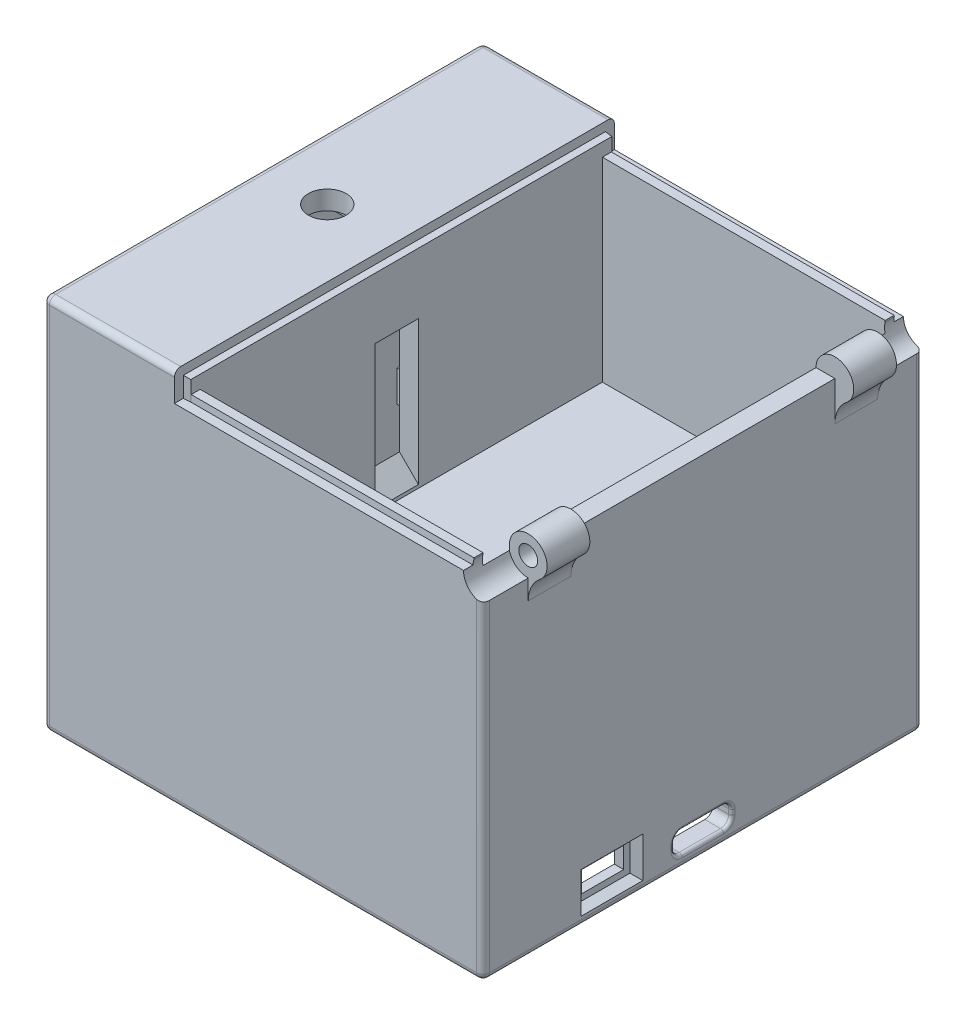
from build123d import *

# Parameters (mm, degrees)
SKETCH_1_W                       = 70
SKETCH_1_H                       = 70
EXTRUDE_1_DEPTH                  = 60
SKETCH_3_W                       = 48
SKETCH_3_H                       = 4.6
CUT_EXTRUDE_1_DEPTH              = 99.615414617
SKETCH_4_W                       = 45
SKETCH_4_H                       = 64
CUT_EXTRUDE_2_DEPTH              = 30
SKETCH_5_R                       = 1.5
CUT_EXTRUDE_3_DEPTH              = 8
SHELL_2_DEPTH                    = 22.4
SHELL_START                      = 11
SHELL_2_2_OUTLINE_W              = 16
SHELL_2_2_OUTLINE_H              = 64
SHELL_2_2_DEPTH                  = 46
SHELL_2_3_DEPTH                  = 11.4
EXTRUDE_2_DEPTH                  = 11
SKETCH_7_R                       = 3
CUT_EXTRUDE_4_DEPTH              = 78.781745931
CUT_EXTRUDE_5_DEPTH              = 2
MACRO_START                      = -14
MACRO_FEATURE_2_DEPTH            = 46
MACRO_START_2                    = 58.576919493
MACRO_FEATURE_3_OUTLINE_W        = 1.1
MACRO_FEATURE_3_OUTLINE_H        = 70
MACRO_FEATURE_3_DEPTH            = 2.423080507
MACRO_START_3                    = 55.4
MACRO_FEATURE_3_2_DEPTH          = 4.6
MACRO_START_4                    = 57.450662782
MACRO_FEATURE_3_3_DEPTH          = 1.549337218
EXTRUDE_START                    = 15
SKETCH_10_W                      = 13.406925948
SKETCH_10_H                      = 1
EXTRUDE_3_DEPTH                  = 8
SKETCH_11_W                      = 5.5
SKETCH_11_H                      = 2.5
CUT_EXTRUDE_6_DEPTH              = 1
EXTRUDE_START_2                  = 38
SKETCH_12_W                      = 4.8
SKETCH_12_H                      = 12.2
SKETCH_12_R                      = 1.1
EXTRUDE_4_DEPTH                  = 5
EXTRUDE_START_3                  = 17.5
SKETCH_13_W                      = 12.2
SKETCH_13_H                      = 5
SKETCH_13_R                      = 1.1
EXTRUDE_5_DEPTH                  = 4
SKETCH_14_R                      = 3
CUT_EXTRUDE_8_DEPTH              = 14
CUT_EXTRUDE_START                = -56
SKETCH_14_2_R                    = 3
CUT_EXTRUDE_9_DEPTH              = 14
EXTRUDE_START_4                  = -0.0001
EXTRUDE_6_OUTLINE_R              = 1.5
EXTRUDE_6_DEPTH                  = 6.8001
EXTRUDE_START_5                  = -42
SKETCH_15_2_R                    = 3
SKETCH_15_2_R_2                  = 1.5
EXTRUDE_7_DEPTH                  = 6.8
CHAMFER_1_SIZE                   = 4
CHAMFER_2_SIZE                   = 4
CHAMFER_3_SIZE                   = 4
CHAMFER_4_SIZE                   = 3
DRAFT_3_ANGLE                    = 10
DRAFT_4_ANGLE                    = 10
SKETCH_16_W                      = 13.480482799
SKETCH_16_H                      = 1.221651596
EXTRUDE_8_DEPTH                  = 1
FILLET_1_R                       = 5
FILLET_2_R                       = 5
CUT_EXTRUDE_10_REACH             = 100.615
SKETCH_19_W                      = 6.720419017
SKETCH_19_H                      = 3.339338642
CUT_EXTRUDE_10_DIRECTION_2_DEPTH = 99.615414617
CUT_EXTRUDE_11_REACH             = 64.178
SKETCH_20_W                      = 16.413114716
SKETCH_20_H                      = 3.11419251
CUT_EXTRUDE_12_REACH             = 88.174
SKETCH_22_W                      = 8.720419017
SKETCH_22_H                      = 5.339338642
CUT_EXTRUDE_13_DEPTH             = 1.5
FILLET_3_R                       = 1
DRAFT_5_ANGLE                    = 20
FILLET_4_R                       = 0.5
SKETCH_23_R                      = 1.5
EXTRUDE_9_DEPTH                  = 1
SKETCH_24_R                      = 1.5
EXTRUDE_10_DEPTH                 = 1
SKETCH_25_R                      = 1.489272612
CUT_EXTRUDE_14_DEPTH             = 2.6
SKETCH_26_R                      = 1.236152459
CUT_EXTRUDE_15_DEPTH             = 2.6
CUT_EXTRUDE_16_REACH             = 101.72
SKETCH_27_R                      = 3.1
CUT_EXTRUDE_START_2              = -7.2
SKETCH_28_R                      = 3.1
CUT_EXTRUDE_17_DEPTH             = 7.2
CUT_EXTRUDE_20_DEPTH             = 0.5
CUT_EXTRUDE_21_DEPTH             = 0.5
CUT_EXTRUDE_22_DEPTH             = 0.5
CUT_EXTRUDE_23_DEPTH             = 0.5
CUT_EXTRUDE_25_DEPTH             = 0.5
SKETCH_31_10_RX                  = 0.631397951
SKETCH_31_10_RY                  = 0.430393735
CUT_EXTRUDE_26_DEPTH             = 0.5
CUT_EXTRUDE_27_DEPTH             = 0.5
CHAMFER_5_SIZE                   = 3
CHAMFER_6_SIZE                   = 3


with BuildPart() as part:
    # 草图1 → 凸台-拉伸1 (new body)
    with BuildSketch(Plane(origin=(0, 0, 0), x_dir=(1, 0, 0), z_dir=(0, 1, 0))):
        Rectangle(SKETCH_1_W, SKETCH_1_H)
    extrude(amount=EXTRUDE_1_DEPTH)

    # 草图3 → 切除-拉伸1 (cut, through all)
    with BuildSketch(Plane.XY.offset(35)):
        with Locations((11, 57.7)):
            Rectangle(SKETCH_3_W, SKETCH_3_H)
    extrude(amount=-CUT_EXTRUDE_1_DEPTH, mode=Mode.SUBTRACT)

    # 草图4 → 切除-拉伸2 (cut)
    with BuildSketch(Plane(origin=(0, 55.4, 0), x_dir=(1, 0, 0), z_dir=(0, 1, 0))):
        with Locations((9.5, 0)):
            Rectangle(SKETCH_4_W, SKETCH_4_H)
    extrude(amount=-CUT_EXTRUDE_2_DEPTH, mode=Mode.SUBTRACT)

    # 草图5 → 切除-拉伸3 (cut)
    with BuildSketch(Plane.XZ):
        with Locations(Location((-28, 28, 0), (0, 0, 270))):
            Circle(SKETCH_5_R)
        with Locations(Location((28, 28, 0), (0, 0, 270))):
            Circle(SKETCH_5_R)
        with Locations(Location((28, -28, 0), (0, 0, 270))):
            Circle(SKETCH_5_R)
        with Locations(Location((-28, -28, 0), (0, 0, 270))):
            Circle(SKETCH_5_R)
    extrude(amount=-CUT_EXTRUDE_3_DEPTH, mode=Mode.SUBTRACT)

    # 抽壳2: read off the stored shape, not the designer's step
    # 抽壳2 outline → 抽壳2 (cut)
    with BuildSketch(Plane(origin=(0, 0, 0), x_dir=(1, 0, 0), z_dir=(0, 1, 0))):
        with BuildLine():
            Line((-30.061552813, 32), (-32, 32))
            Line((-32, 32), (-32, 30.061552813))
            ThreePointArc((-32, 30.061552813), (-31.181980515, 31.181980515), (-30.061552813, 32))
        make_face()
        with BuildLine():
            ThreePointArc((-25.938447187, 32), (-24.818019485, 24.818019485), (-32, 25.938447187))
            Line((-32, 25.938447187), (-32, -25.938447187))
            ThreePointArc((-32, -25.938447187), (-24.818019485, -24.818019485), (-25.938447187, -32))
            Line((-25.938447187, -32), (25.938447187, -32))
            ThreePointArc((25.938447187, -32), (24.818019485, -24.818019485), (32, -25.938447187))
            Line((32, -25.938447187), (32, 25.938447187))
            ThreePointArc((32, 25.938447187), (24.818019485, 24.818019485), (25.938447187, 32))
            Line((25.938447187, 32), (-25.938447187, 32))
        make_face()
        with BuildLine():
            ThreePointArc((-30.061552813, -32), (-31.181980515, -31.181980515), (-32, -30.061552813))
            Line((-32, -30.061552813), (-32, -32))
            Line((-32, -32), (-30.061552813, -32))
        make_face()
        with BuildLine():
            Line((32, 32), (30.061552813, 32))
            ThreePointArc((30.061552813, 32), (31.181980515, 31.181980515), (32, 30.061552813))
            Line((32, 30.061552813), (32, 32))
        make_face()
        with BuildLine():
            ThreePointArc((32, -30.061552813), (31.181980515, -31.181980515), (30.061552813, -32))
            Line((30.061552813, -32), (32, -32))
            Line((32, -32), (32, -30.061552813))
        make_face()
    extrude(amount=SHELL_2_DEPTH, mode=Mode.SUBTRACT)

    # Shell 2 2 outline → Shell 2 2 (cut)
    with BuildSketch(Plane(origin=(0, 0, 0), x_dir=(1, 0, 0), z_dir=(0, 1, 0)).offset(SHELL_START)):
        with Locations((-24, 0)):
            Rectangle(SHELL_2_2_OUTLINE_W, SHELL_2_2_OUTLINE_H)
    extrude(amount=SHELL_2_2_DEPTH, mode=Mode.SUBTRACT)

    # Shell 2 3 outline → Shell 2 3 (cut)
    with BuildSketch(Plane(origin=(0, 0, 0), x_dir=(1, 0, 0), z_dir=(0, 1, 0)).offset(SHELL_START)):
        with BuildLine():
            Line((30.061552813, 32), (25.938447187, 32))
            ThreePointArc((25.938447187, 32), (24.818019485, 24.818019485), (32, 25.938447187))
            Line((32, 25.938447187), (32, 30.061552813))
            ThreePointArc((32, 30.061552813), (31.181980515, 31.181980515), (30.061552813, 32))
        make_face()
        with BuildLine():
            ThreePointArc((32, -25.938447187), (24.818019485, -24.818019485), (25.938447187, -32))
            Line((25.938447187, -32), (30.061552813, -32))
            ThreePointArc((30.061552813, -32), (31.181980515, -31.181980515), (32, -30.061552813))
            Line((32, -30.061552813), (32, -25.938447187))
        make_face()
    extrude(amount=SHELL_2_3_DEPTH, mode=Mode.SUBTRACT)

    # 草图6 → 凸台-拉伸2 (add)
    with BuildSketch(Plane.XZ):
        with BuildLine():
            Line((-32, 30.061552813), (-32, 32))
            Line((-32, 32), (-30.061552813, 32))
            ThreePointArc((-30.061552813, 32), (-31.181980515, 31.181980515), (-32, 30.061552813))
        make_face()
        with BuildLine():
            Line((32, 32), (32, 30.061552813))
            ThreePointArc((32, 30.061552813), (31.181980515, 31.181980515), (30.061552813, 32))
            Line((30.061552813, 32), (32, 32))
        make_face()
        with BuildLine():
            Line((-32, -32), (-32, -30.061552813))
            ThreePointArc((-32, -30.061552813), (-31.181980515, -31.181980515), (-30.061552813, -32))
            Line((-30.061552813, -32), (-32, -32))
        make_face()
        with BuildLine():
            Line((32, -30.061552813), (32, -32))
            Line((32, -32), (30.061552813, -32))
            ThreePointArc((30.061552813, -32), (31.181980515, -31.181980515), (32, -30.061552813))
        make_face()
    extrude(amount=-EXTRUDE_2_DEPTH)

    # 草图7 → 切除-拉伸4 (cut, through all)
    with BuildSketch(Plane(origin=(0, 60, 0), x_dir=(1, 0, 0), z_dir=(0, 1, 0))):
        with Locations(Location((-24.782622857, 0, 0), (0, 0, 270))):
            Circle(SKETCH_7_R)
    extrude(amount=-CUT_EXTRUDE_4_DEPTH, mode=Mode.SUBTRACT)

    # 草图8 → 切除-拉伸5 (cut)
    with BuildSketch(Plane.XZ):
        with BuildLine():
            Line((-29, 32), (29, 32))
            ThreePointArc((29, 32), (31.121320344, 31.121320344), (32, 29))
            Line((32, 29), (32, -29))
            ThreePointArc((32, -29), (31.121320344, -31.121320344), (29, -32))
            Line((29, -32), (-29, -32))
            ThreePointArc((-29, -32), (-31.121320344, -31.121320344), (-32, -29))
            Line((-32, -29), (-32, 29))
            ThreePointArc((-32, 29), (-31.121320344, 31.121320344), (-29, 32))
        make_face()
    extrude(amount=-CUT_EXTRUDE_5_DEPTH, mode=Mode.SUBTRACT)

    # Macro Feature 2: read off the stored shape, not the designer's step
    # Macro Feature 2 outline → Macro Feature 2 (add)
    with BuildSketch(Plane.YZ.offset(MACRO_START)):
        Polygon((55.4, -32), (55.4, -33.5), (56.4, -33.430073188), (56.4, -32), align=None)
        Polygon((55.4, 33.5), (55.4, 32), (56.4, 32), (56.4, 33.430073188), align=None)
    extrude(amount=MACRO_FEATURE_2_DEPTH)

    # Macro Feature 3: read off the stored shape, not the designer's step
    # Macro Feature 3 outline → Macro Feature 3 (cut)
    with BuildSketch(Plane(origin=(0, 0, 0), x_dir=(1, 0, 0), z_dir=(0, 1, 0)).offset(MACRO_START_2)):
        with Locations((-13.55, 0)):
            Rectangle(MACRO_FEATURE_3_OUTLINE_W, MACRO_FEATURE_3_OUTLINE_H)
    extrude(amount=MACRO_FEATURE_3_DEPTH, mode=Mode.SUBTRACT)

    # Macro Feature 3 2 outline → Macro Feature 3 2 (cut)
    with BuildSketch(Plane(origin=(0, 0, 0), x_dir=(1, 0, 0), z_dir=(0, 1, 0)).offset(MACRO_START_3)):
        Polygon((-14.1, 35), (-14.1, 33.576919493), (-13, 33.5), (-13, 35), align=None)
        Polygon((-13, -33.5), (-14.1, -33.576919493), (-14.1, -35), (-13, -35), align=None)
    extrude(amount=MACRO_FEATURE_3_2_DEPTH, mode=Mode.SUBTRACT)

    # Macro Feature 3 3 outline → Macro Feature 3 3 (cut)
    with BuildSketch(Plane(origin=(0, 0, 0), x_dir=(0.9975640502598242, -0.06975647374412533, 0), z_dir=(0.06975647374412533, 0.9975640502598243, 0)).offset(MACRO_START_4)):
        Polygon((-18.151772455, -33.576919493), (-17.049086367, -33.5), (-17.049086367, 33.5), (-18.151772455, 33.576919493), align=None)
    extrude(amount=MACRO_FEATURE_3_3_DEPTH, mode=Mode.SUBTRACT)

    # 草图10 → 凸台-拉伸3 (add)
    with BuildSketch(Plane.XY.offset(-32).offset(EXTRUDE_START)):
        with Locations((-22.703462974, 56.5)):
            Rectangle(SKETCH_10_W, SKETCH_10_H)
    extrude(amount=EXTRUDE_3_DEPTH)

    # 草图11 → 切除-拉伸6 (cut)
    with BuildSketch(Plane.XZ.offset(-56)):
        with Locations((-18.75, -13.25)):
            Rectangle(SKETCH_11_W, SKETCH_11_H)
        with Locations((-25.35, -13.25)):
            Rectangle(SKETCH_11_W, SKETCH_11_H)
    extrude(amount=-CUT_EXTRUDE_6_DEPTH, mode=Mode.SUBTRACT)

    # 草图12 → 凸台-拉伸4 (add)
    # profile 1 of 2: a face of its own
    with BuildSketch(Plane.XY.offset(-32).offset(EXTRUDE_START_2)):
        with Locations((1.8, 16.3)):
            Rectangle(SKETCH_12_W, SKETCH_12_H)
        with Locations((1.8, 16.3)):
            Circle(SKETCH_12_R, mode=Mode.SUBTRACT)
    # profile 2 of 2: a face of its own
    with BuildSketch(Plane.XY.offset(-32).offset(EXTRUDE_START_2)):
        with Locations((29.6, 16.3)):
            Rectangle(SKETCH_12_W, SKETCH_12_H)
        with Locations((29.6, 16.3)):
            Circle(SKETCH_12_R, mode=Mode.SUBTRACT)
    extrude(amount=EXTRUDE_4_DEPTH)

    # 草图13 → 凸台-拉伸5 (add)
    with BuildSketch(Plane.XY.offset(-32).offset(EXTRUDE_START_3)):
        with Locations((-22.1, 26)):
            Rectangle(SKETCH_13_W, SKETCH_13_H)
        with Locations((-22.1, 27.05)):
            Circle(SKETCH_13_R, mode=Mode.SUBTRACT)
    extrude(amount=-EXTRUDE_5_DEPTH)

    # 草图14 → 切除-拉伸8 (cut)
    with BuildSketch(Plane.XY.offset(35)):
        with Locations((35, 55.4)):
            Circle(SKETCH_14_R)
    extrude(amount=-CUT_EXTRUDE_8_DEPTH, mode=Mode.SUBTRACT)

    # 草图14<2> → 切除-拉伸9 (cut)
    with BuildSketch(Plane.XY.offset(35).offset(CUT_EXTRUDE_START)):
        with Locations((35, 55.4)):
            Circle(SKETCH_14_2_R)
    extrude(amount=-CUT_EXTRUDE_9_DEPTH, mode=Mode.SUBTRACT)

    # 凸台-拉伸6: read off the stored shape, not the designer's step
    # 凸台-拉伸6 outline → 凸台-拉伸6 (add)
    with BuildSketch(Plane.XY.offset(21).offset(EXTRUDE_START_4)):
        with BuildLine():
            ThreePointArc((32, 55.4), (32.878679656, 53.278679656), (35, 52.4))
            ThreePointArc((35, 52.4), (37.121320344, 57.521320344), (32, 55.4))
        make_face()
        with Locations((35, 55.4)):
            Circle(EXTRUDE_6_OUTLINE_R, mode=Mode.SUBTRACT)
    extrude(amount=EXTRUDE_6_DEPTH)

    # 草图15<2> → 凸台-拉伸7 (add)
    with BuildSketch(Plane.XY.offset(21).offset(EXTRUDE_START_5)):
        with Locations((35, 55.4)):
            Circle(SKETCH_15_2_R)
        with Locations((35, 55.4)):
            Circle(SKETCH_15_2_R_2, mode=Mode.SUBTRACT)
    extrude(amount=-EXTRUDE_7_DEPTH)

    # 倒角1
    chamfer_1_edges = [part.edges().sort_by_distance(p)[0] for p in [
        (1.8, 22.4, 6),
    ]]
    chamfer(chamfer_1_edges, length=CHAMFER_1_SIZE)

    # 倒角2
    chamfer_2_edges = [part.edges().sort_by_distance(p)[0] for p in [
        (-0.6, 22.4, 6.5),
    ]]
    chamfer(chamfer_2_edges, length=CHAMFER_2_SIZE)

    # 倒角3
    # the kernel refuses this chamfer: 4 mm, written as the material it adds along each edge
    with BuildSketch(Plane(origin=(-16, 23.5, -14.5), x_dir=(0, -1, 0), z_dir=(0, 0, -1))) as chamfer_3_piece_1_section:
        Polygon((CHAMFER_3_SIZE, 0), (0, CHAMFER_3_SIZE), (0, 0), align=None)
    chamfer_3_piece_1 = extrude(amount=4, mode=Mode.PRIVATE)
    chamfer_3_piece_1 = split(chamfer_3_piece_1, bisect_by=Plane(origin=(-16, 22.4, -14.5), z_dir=(0, 1, 0)), keep=Keep.TOP, mode=Mode.PRIVATE)
    add(chamfer_3_piece_1)

    # 倒角4
    chamfer_4_edges = [part.edges().sort_by_distance(p)[0] for p in [
        (-16, 25.45, -18.5),
    ]]
    chamfer(chamfer_4_edges, length=CHAMFER_4_SIZE)

    # 拔模3
    draft_3_faces = [part.faces().sort_by_distance(p)[0] for p in [
        (-18.75, 56.5, -12),
        (-21.5, 56.5, -13.25),
        (-18.75, 56.5, -14.5),
    ]]
    draft(draft_3_faces, Plane(origin=(0, 57, 0), x_dir=(0, 0, -1), z_dir=(0, -1, 0)), DRAFT_3_ANGLE)

    # 拔模4
    draft_4_faces = [part.faces().sort_by_distance(p)[0] for p in [
        (-28.1, 56.5, -13.25),
        (-25.35, 56.5, -12),
        (-25.35, 56.5, -14.5),
        (-22.6, 56.5, -13.25),
    ]]
    draft(draft_4_faces, Plane(origin=(0, 57, 0), x_dir=(0, 0, -1), z_dir=(0, -1, 0)), DRAFT_4_ANGLE)

    # 草图16 → 凸台-拉伸8 (add)
    with BuildSketch(Plane.XZ.offset(-57)):
        with Locations((-24.782622857, -4.273489786)):
            Rectangle(SKETCH_16_W, SKETCH_16_H)
        with Locations((-24.782622857, 4.273489786)):
            Rectangle(SKETCH_16_W, SKETCH_16_H)
    extrude(amount=EXTRUDE_8_DEPTH)

    # 圆角1
    fillet_1_edges = [part.edges().sort_by_distance(p)[0] for p in [
        (35, 52.4, 24.39995),
    ]]
    fillet(fillet_1_edges, radius=FILLET_1_R)

    # 圆角2
    fillet_2_edges = [part.edges().sort_by_distance(p)[0] for p in [
        (35, 52.4, -24.4),
    ]]
    fillet(fillet_2_edges, radius=FILLET_2_R)

    # 草图19 → 切除-拉伸10 (cut, up to next)
    with BuildSketch(Plane(origin=(35, 0, 0), x_dir=(0, 0, -1), z_dir=(1, 0, 0)), mode=Mode.PRIVATE) as cut_extrude_10_sk1:
        with Locations((-14.471315698, 4.702200093)):
            Rectangle(SKETCH_19_W, SKETCH_19_H)
    cut_extrude_10_tool1 = extrude(cut_extrude_10_sk1.sketch, amount=-CUT_EXTRUDE_10_REACH, mode=Mode.PRIVATE) & part.part
    # 草图19 → 切除-拉伸10 (cut, up to next)
    with BuildSketch(Plane(origin=(35, 0, 0), x_dir=(0, 0, -1), z_dir=(1, 0, 0)), mode=Mode.PRIVATE) as cut_extrude_10_sk2:
        with BuildLine():
            Line((-3.282090948, 5.352712816), (3.293659264, 5.352712816))
            ThreePointArc((3.293659264, 5.352712816), (4.21289808, 4.971951631), (4.593659264, 4.052712816))
            Line((4.593659264, 4.052712816), (4.593659264, 3.28436082))
            ThreePointArc((4.593659264, 3.28436082), (4.21289808, 2.365122004), (3.293659264, 1.98436082))
            Line((3.293659264, 1.98436082), (-3.282090948, 1.98436082))
            ThreePointArc((-3.282090948, 1.98436082), (-4.201329763, 2.365122004), (-4.582090948, 3.28436082))
            Line((-4.582090948, 3.28436082), (-4.582090948, 4.052712816))
            ThreePointArc((-4.582090948, 4.052712816), (-4.201329763, 4.971951631), (-3.282090948, 5.352712816))
        make_face()
    cut_extrude_10_tool2 = extrude(cut_extrude_10_sk2.sketch, amount=-CUT_EXTRUDE_10_REACH, mode=Mode.PRIVATE) & part.part
    add(cut_extrude_10_tool1.solids().sort_by_distance((35, 4.7022, 14.471316))[0], mode=Mode.SUBTRACT)
    add(cut_extrude_10_tool2.solids().sort_by_distance((35, 3.668537, -0.005784))[0], mode=Mode.SUBTRACT)

    # 草图19 → 切除-拉伸10 direction 2 (cut)
    with BuildSketch(Plane(origin=(35, 0, 0), x_dir=(0, 0, -1), z_dir=(1, 0, 0))):
        with Locations((-14.471315698, 4.702200093)):
            Rectangle(SKETCH_19_W, SKETCH_19_H)
        with BuildLine():
            Line((-3.282090948, 5.352712816), (3.293659264, 5.352712816))
            ThreePointArc((3.293659264, 5.352712816), (4.21289808, 4.971951631), (4.593659264, 4.052712816))
            Line((4.593659264, 4.052712816), (4.593659264, 3.28436082))
            ThreePointArc((4.593659264, 3.28436082), (4.21289808, 2.365122004), (3.293659264, 1.98436082))
            Line((3.293659264, 1.98436082), (-3.282090948, 1.98436082))
            ThreePointArc((-3.282090948, 1.98436082), (-4.201329763, 2.365122004), (-4.582090948, 3.28436082))
            Line((-4.582090948, 3.28436082), (-4.582090948, 4.052712816))
            ThreePointArc((-4.582090948, 4.052712816), (-4.201329763, 4.971951631), (-3.282090948, 5.352712816))
        make_face()
    extrude(amount=CUT_EXTRUDE_10_DIRECTION_2_DEPTH, mode=Mode.SUBTRACT)

    # 草图20 → 切除-拉伸11 (cut, up to next)
    with BuildSketch(Plane(origin=(0, 25.4, 0), x_dir=(1, 0, 0), z_dir=(0, 1, 0)), mode=Mode.PRIVATE) as cut_extrude_11_sk1:
        with Locations((12.045919254, -27.995037997)):
            Rectangle(SKETCH_20_W, SKETCH_20_H)
    cut_extrude_11_tool1 = extrude(cut_extrude_11_sk1.sketch, amount=-CUT_EXTRUDE_11_REACH, mode=Mode.PRIVATE) & part.part
    add(cut_extrude_11_tool1.solids().sort_by_distance((12.045919, 25.4, 27.995038))[0], mode=Mode.SUBTRACT)

    # 草图21 → 切除-拉伸12 (cut, up to next)
    with BuildSketch(Plane(origin=(-13, 0, 0), x_dir=(0, 0, -1), z_dir=(1, 0, 0)), mode=Mode.PRIVATE) as cut_extrude_12_sk1:
        Polygon((-1.925569226, 28.925275814), (2.717895465, 28.925275814), (2.717895465, 45.796407981), (-3.140485278, 45.796407981), (-4.150485278, 45.796407981), (-4.150485278, 28.925275814), align=None)
    cut_extrude_12_tool1 = extrude(cut_extrude_12_sk1.sketch, amount=-CUT_EXTRUDE_12_REACH, mode=Mode.PRIVATE) & part.part
    add(cut_extrude_12_tool1.solids().sort_by_distance((-13, 37.360842, 0.716295))[0], mode=Mode.SUBTRACT)

    # 草图22 → 切除-拉伸13 (cut)
    with BuildSketch(Plane(origin=(35, 0, 0), x_dir=(0, 0, -1), z_dir=(1, 0, 0))):
        with Locations((-14.471315698, 4.702200093)):
            Rectangle(SKETCH_22_W, SKETCH_22_H)
    extrude(amount=-CUT_EXTRUDE_13_DEPTH, mode=Mode.SUBTRACT)

    # 圆角3
    fillet_3_edges = [part.edges().sort_by_distance(p)[0] for p in [
        (-35, 60, 0),
        (-24.55, 60, 35),
        (-24.55, 60, -35),
        (35, 26.2, 35),
        (35, 26.2, -35),
        (0, 0, 35),
        (-35, 0, 0),
        (0, 0, -35),
        (35, 0, 0),
        (-35, 30, 35),
        (-35, 30, -35),
    ]]
    fillet(fillet_3_edges, radius=FILLET_3_R)

    # 拔模5
    draft_5_faces = [part.faces().sort_by_distance(p)[0] for p in [
        (34.25, 4.702200093, 10.111106189),
        (34.25, 2.032530772, 14.471315698),
        (34.25, 4.702200093, 18.831525206),
        (34.25, 7.371869414, 14.471315698),
    ]]
    draft(draft_5_faces, Plane(origin=(33.5, 0, 0), x_dir=(0, 0, 1), z_dir=(1, 0, 0)), DRAFT_5_ANGLE)

    # 圆角4
    fillet_4_edges = [part.edges().sort_by_distance(p)[0] for p in [
        (35, 4.971951631, -4.21289808),
        (35, 5.352712816, -0.005784158),
        (35, 4.971951631, 4.201329763),
        (35, 3.668536818, 4.582090948),
        (35, 2.365122004, 4.201329763),
        (35, 1.98436082, -0.005784158),
        (35, 2.365122004, -4.21289808),
        (35, 3.668536818, -4.593659264),
    ]]
    fillet(fillet_4_edges, radius=FILLET_4_R)

    # 草图23 → 凸台-拉伸9 (add)
    with BuildSketch(Plane(origin=(0, 0, -21), x_dir=(-1, 0, 0), z_dir=(0, 0, -1))):
        with Locations(Location((-35, 55.4, 0), (0, 0, 180))):
            Circle(SKETCH_23_R)
    extrude(amount=EXTRUDE_9_DEPTH)

    # 草图24 → 凸台-拉伸10 (add)
    with BuildSketch(Plane.XY.offset(21).offset(EXTRUDE_START_4)):
        with Locations((35, 55.4)):
            Circle(SKETCH_24_R)
    extrude(amount=EXTRUDE_10_DEPTH)

    # 草图25 → 切除-拉伸14 (cut)
    with BuildSketch(Plane(origin=(-32, 0, 0), x_dir=(0, 0, -1), z_dir=(1, 0, 0))):
        with Locations((0, 5.163556875)):
            Circle(SKETCH_25_R)
    extrude(amount=-CUT_EXTRUDE_14_DEPTH, mode=Mode.SUBTRACT)

    # 草图26 → 切除-拉伸15 (cut)
    with BuildSketch(Plane.ZY.offset(-32)):
        with Locations((-14.628642463, 5.12878904)):
            Circle(SKETCH_26_R)
    extrude(amount=-CUT_EXTRUDE_15_DEPTH, mode=Mode.SUBTRACT)

    # 切除-拉伸16: up to this face of the body (flat: up to its plane)
    cut_extrude_16_end = Plane(part.part.faces().sort_by_distance((36.251314294, 58.004818419, 27.8))[0])
    # 草图27 → 切除-拉伸16 (cut, up to the picked face)
    with BuildSketch(Plane.XY.offset(35), mode=Mode.PRIVATE) as cut_extrude_16_sk1:
        with Locations((35, 55.4)):
            Circle(SKETCH_27_R)
    cut_extrude_16_tool1 = split(extrude(cut_extrude_16_sk1.sketch, amount=-CUT_EXTRUDE_16_REACH, mode=Mode.PRIVATE), bisect_by=cut_extrude_16_end, keep=Keep.BOTH, mode=Mode.PRIVATE)
    add(cut_extrude_16_tool1.solids().sort_by(Axis((35, 55.4, 35), (0, 0, -1)))[0], mode=Mode.SUBTRACT)

    # 草图28 → 切除-拉伸17 (cut)
    with BuildSketch(Plane(origin=(0, 0, -35), x_dir=(-1, 0, 0), z_dir=(0, 0, -1)).offset(CUT_EXTRUDE_START_2)):
        with Locations((-35, 55.4)):
            Circle(SKETCH_28_R)
    extrude(amount=CUT_EXTRUDE_17_DEPTH, mode=Mode.SUBTRACT)

    # 草图31 → 切除-拉伸20 (cut)
    with BuildSketch(Plane.ZY.offset(35)):
        with BuildLine():
            ThreePointArc((-10.265851901, 18.360669901), (-10.029908814, 17.694088428), (-10.696490286, 17.458145341))
            add(Edge.make_bspline(
                [(-10.696490286, 17.458145341), (-11.783829753, 17.976967911), (-13.774523959, 19.404346263), (-16.025451109, 22.3509324), (-17.508166157, 25.828746889), (-18.14813611, 29.56317571), (-17.854387079, 33.279328217), (-16.785989153, 36.152393101), (-15.299198462, 38.12143868), (-13.961710402, 38.94288109), (-12.639482873, 39.161835755), (-11.544001589, 39.073394294), (-10.542882892, 38.770713827), (-9.696274399, 38.388357182), (-9.236437399, 38.136512032), (-9.017479419, 38.006938283)],
                knots=[0, 0, 0, 0, 0.125, 0.25, 0.375, 0.5, 0.625, 0.75, 0.8125, 0.875, 0.90625, 0.9375, 0.96875, 0.984375, 1, 1, 1, 1], degree=3))
            ThreePointArc((-9.017479419, 38.006938283), (-8.841819955, 37.321997589), (-9.526760648, 37.146338126))
            add(Edge.make_bspline(
                [(-10.265851901, 18.360669901), (-11.255421756, 18.832841831), (-13.055574756, 20.122438259), (-15.150519891, 22.854412291), (-16.540295194, 26.113314609), (-17.138247585, 29.614046846), (-16.913436863, 32.497302301), (-16.269073945, 34.632873105), (-15.546595478, 36.142655717), (-14.586229757, 37.384709681), (-13.587175287, 37.98721801), (-12.607596192, 38.151910244), (-11.745049943, 38.086191675), (-10.89547929, 37.832009961), (-10.146314373, 37.49435915), (-9.725575684, 37.263991795), (-9.526760648, 37.146338126)],
                knots=[0, 0, 0, 0, 0.125, 0.25, 0.375, 0.5, 0.625, 0.6875, 0.75, 0.8125, 0.875, 0.90625, 0.9375, 0.96875, 0.984375, 1, 1, 1, 1], degree=3))
        make_face()
    extrude(amount=-CUT_EXTRUDE_20_DEPTH, mode=Mode.SUBTRACT)

    # 草图31<3> → 切除-拉伸21 (cut)
    with BuildSketch(Plane.ZY.offset(35)):
        with BuildLine():
            ThreePointArc((-7.828448831, 39.172095114), (-7.125671128, 39.09397022), (-7.203796021, 38.391192516))
            add(Edge.make_bspline(
                [(-7.203796021, 38.391192516), (-7.699956892, 37.99430783), (-8.627879158, 37.147445256), (-10.348263844, 35.117662262), (-11.933484864, 32.169260183), (-12.273963716, 28.387828001), (-11.018584034, 25.277558287), (-9.411546927, 23.255091786), (-7.47221719, 21.635507933), (-4.518719679, 20.21534403), (-1.240594519, 19.342123273), (1.363750855, 18.787555271), (2.584563051, 18.535270194), (3.203601823, 18.398894969)],
                knots=[0, 0, 0, 0, 0.0625, 0.125, 0.25, 0.375, 0.5, 0.5625, 0.625, 0.75, 0.875, 0.9375, 1, 1, 1, 1], degree=3))
            ThreePointArc((3.203601823, 18.398894969), (3.584321782, 17.803032306), (2.988459119, 17.422312347))
            add(Edge.make_bspline(
                [(-7.828448831, 39.172095114), (-8.358384097, 38.748193907), (-9.349906796, 37.843156553), (-11.185306605, 35.678936375), (-12.55134707, 33.136094115), (-13.123650457, 30.367144597), (-13.005621098, 27.51338722), (-11.907994105, 24.787491946), (-10.130783294, 22.550195177), (-7.993837962, 20.768561418), (-5.475275218, 19.565636991), (-2.816550381, 18.726516838), (-0.808064681, 18.227505725), (0.826213273, 17.879676329), (2.088161443, 17.616525078), (2.685935866, 17.4889587), (2.988459119, 17.422312347)],
                knots=[0, 0, 0, 0, 0.0625, 0.125, 0.25, 0.3125, 0.375, 0.5, 0.5625, 0.625, 0.75, 0.8125, 0.875, 0.9375, 0.96875, 1, 1, 1, 1], degree=3))
        make_face()
    extrude(amount=-CUT_EXTRUDE_21_DEPTH, mode=Mode.SUBTRACT)

    # 草图31<4> → 切除-拉伸22 (cut)
    with BuildSketch(Plane.ZY.offset(35)):
        with BuildLine():
            ThreePointArc((-7.056250527, 38.585384199), (-7.712382042, 38.321771916), (-7.975994325, 38.977903431))
            add(Edge.make_bspline(
                [(-7.975994325, 38.977903431), (-7.835704274, 39.306628482), (-7.594438813, 39.965759769), (-7.150927521, 41.41225827), (-6.709737517, 42.934094248), (-6.080877101, 44.429273243), (-5.465119138, 45.507785531), (-4.656378147, 46.495715838), (-3.782452221, 47.245398977), (-2.923287476, 47.683746827), (-2.144465187, 47.794512386), (-1.417323338, 47.548733668), (-0.631615315, 46.99255802), (0.130155531, 46.131567422), (0.794839008, 45.0892194), (1.297694216, 44.000676193), (1.655823507, 43.08896052), (1.949477934, 42.320053153), (2.182977101, 41.810055779), (2.332771692, 41.678090569), (2.720351401, 41.559503798), (3.303797916, 41.538739507), (4.214471826, 41.537604634), (5.302120613, 41.31734058), (6.439793457, 40.760916805), (7.342464665, 40.11982803), (7.968146718, 39.821766424), (8.343794559, 39.755698592), (8.672561088, 39.834241566), (9.149944028, 40.133058672), (9.606932257, 40.535771798), (9.996833648, 40.920343535), (10.315666776, 41.185594014), (10.571140813, 41.320753153), (10.732221111, 41.399633163), (11.040024376, 41.627172179), (11.690607366, 42.090264631), (12.765862939, 42.692289545), (14.36625935, 43.304389338), (16.034210332, 43.009774172), (16.911534344, 42.075830034), (17.087228788, 41.088434848), (17.043910538, 40.562905971), (17.019686113, 40.198783919), (17.017023304, 39.984606375), (17.036793353, 39.762205425), (17.090926115, 39.357370045), (17.181061884, 38.736135715), (17.204545446, 38.114817367), (17.186979776, 37.820392537)],
                knots=[0, 0, 0, 0, 0.031244859, 0.062489718, 0.124979436, 0.156224295, 0.187469155, 0.218714014, 0.249958873, 0.265581302, 0.281203732, 0.296826161, 0.312448591, 0.34369345, 0.374938309, 0.406183168, 0.437428027, 0.453050457, 0.468672886, 0.484295316, 0.499917746, 0.515540175, 0.531162605, 0.562407464, 0.593652323, 0.624897182, 0.640519611, 0.656142041, 0.671764471, 0.6873869, 0.70300933, 0.718631759, 0.734254189, 0.749876618, 0.765499048, 0.781121477, 0.796743907, 0.812366336, 0.843611196, 0.874856055, 0.906100914, 0.921723343, 0.937345773, 0.945156988, 0.952968202, 0.960779417, 0.968590632, 0.984213062, 0.999835491, 0.999835491, 0.999835491, 0.999835491], degree=3))
            add(Edge.make_bspline(
                [(17.186979776, 37.820392537), (17.176205637, 37.366816702), (17.115553422, 36.694413266), (17.029025003, 35.774534489), (16.98533277, 35.108809432), (16.966994248, 34.522943895), (16.917876723, 34.031475131), (16.849296803, 33.652232712), (16.745995369, 33.273696575), (16.555361295, 32.869615024), (16.446136736, 32.621880083), (16.44972949, 32.626977666), (16.545541636, 32.291471675), (16.691013575, 31.835037066), (16.838776815, 31.275975189), (16.983144032, 30.592308974), (17.126452309, 29.673137411), (17.222454013, 28.50489162), (17.216908517, 26.601003029), (16.968648191, 24.114657116), (16.257187958, 21.724458763), (15.293615361, 20.059643504), (14.343026828, 18.986865637), (13.336493288, 18.292268138), (12.407845338, 17.890934654), (11.88851061, 17.74303927), (11.629702744, 17.686414511)],
                knots=[0.000448266, 0.000448266, 0.000448266, 0.000448266, 0.06292025, 0.094156241, 0.125392233, 0.156628225, 0.17224622, 0.187864216, 0.203482212, 0.219100208, 0.234718204, 0.2503362, 0.265954196, 0.281572191, 0.312808183, 0.344044175, 0.375280166, 0.43775215, 0.500224133, 0.6251681, 0.750112067, 0.81258405, 0.875056033, 0.937528017, 0.968764008, 1, 1, 1, 1], degree=3))
            ThreePointArc((11.629702744, 17.686414511), (11.034389468, 18.067992947), (11.415967905, 18.663306224))
            add(Edge.make_bspline(
                [(16.187682961, 37.862453984), (16.182942482, 37.654218992), (16.160424106, 37.249311406), (16.100402758, 36.576411662), (16.034423563, 35.884106133), (15.986293172, 35.158725961), (15.968833669, 34.59267619), (15.927307277, 34.178940609), (15.877418266, 33.889755071), (15.797886855, 33.613122448), (15.699632453, 33.377793462), (15.527754175, 33.078513644), (15.443614136, 32.677488568), (15.486359899, 32.292010329), (15.597240173, 31.992824627), (15.720931233, 31.576398156), (15.864279691, 31.054775568), (15.996228468, 30.425579619), (16.130824225, 29.571742203), (16.221473766, 28.479606699), (16.217875666, 26.673652941), (15.980875247, 24.298136641), (15.320664671, 22.102689534), (14.474519583, 20.644940193), (13.671548365, 19.741187919), (12.842155621, 19.169309748), (12.073658464, 18.836290002), (11.633947122, 18.710998053), (11.415967905, 18.663306224)],
                knots=[-0.000479714, -0.000479714, -0.000479714, -0.000479714, 0.030785277, 0.062050268, 0.093315259, 0.12458025, 0.155845241, 0.171477737, 0.187110232, 0.202742728, 0.218375224, 0.234007719, 0.241823967, 0.249640215, 0.26527271, 0.280905206, 0.312170197, 0.343435188, 0.374700179, 0.437230161, 0.499760143, 0.624820107, 0.749880072, 0.812410054, 0.874940036, 0.937470018, 0.968735009, 1, 1, 1, 1], degree=3))
            add(Edge.make_bspline(
                [(-7.056250527, 38.585384199), (-6.75398666, 39.293643299), (-6.298481451, 40.767460214), (-5.757339816, 42.620962235), (-5.178333773, 43.993518898), (-4.632036914, 44.94479526), (-4.055083094, 45.653198447), (-3.489944372, 46.169336957), (-3.027899547, 46.512211946), (-2.577501817, 46.722472516), (-2.248946033, 46.764541405), (-1.900508232, 46.655616718), (-1.477020875, 46.368890877), (-1.06223747, 45.960623072), (-0.569837143, 45.371981617), (-0.088091202, 44.611239759), (0.297648705, 43.782614781), (0.584268942, 43.078737316), (0.799576427, 42.525084272), (1.020478444, 41.965695847), (1.233375554, 41.432253518), (1.576556915, 40.999203296), (2.034805528, 40.695288351), (2.630260285, 40.560455487), (3.321588724, 40.538919797), (4.146810797, 40.535570968), (4.964168793, 40.358895806), (5.910629391, 39.91225643), (6.788098717, 39.282407329), (7.622369918, 38.872127185), (8.355746915, 38.719486384), (9.152744464, 38.931329026), (9.77520918, 39.353242702), (10.302361222, 39.816050124), (10.707499732, 40.214625614), (10.887066123, 40.356247153), (10.993673197, 40.413098513), (11.271797457, 40.553534583), (11.680044893, 40.856886329), (12.221037924, 41.239827577), (12.963424888, 41.65550375), (13.760963226, 41.999562409), (14.716547249, 42.231310587), (15.561213048, 42.03945272), (15.983445835, 41.557857039), (16.075176391, 41.079928232), (16.041447458, 40.548559221), (16.000740332, 39.927793322), (16.088528462, 39.316360541), (16.186231198, 38.60905468), (16.202869373, 38.108473858), (16.187682961, 37.862453984)],
                knots=[0, 0, 0, 0, 0.062511316, 0.125022631, 0.156278289, 0.187533947, 0.218789604, 0.234417433, 0.250045262, 0.265673091, 0.28130092, 0.296928749, 0.312556578, 0.328184406, 0.343812235, 0.375067893, 0.406323551, 0.42195138, 0.437579209, 0.453207037, 0.468834866, 0.476648781, 0.484462695, 0.500090524, 0.515718353, 0.531346182, 0.56260184, 0.593857497, 0.625113155, 0.640740984, 0.656368813, 0.671996642, 0.687624471, 0.7032523, 0.718880128, 0.734507957, 0.750135786, 0.765763615, 0.781391444, 0.797019273, 0.812647102, 0.828274931, 0.843902759, 0.875158417, 0.906414075, 0.922041904, 0.937669733, 0.953297562, 0.96892539, 0.984553219, 1.000181048, 1.000181048, 1.000181048, 1.000181048], degree=3))
        make_face()
    extrude(amount=-CUT_EXTRUDE_22_DEPTH, mode=Mode.SUBTRACT)

    # 草图31<6> → 切除-拉伸23 (cut)
    with BuildSketch(Plane.ZY.offset(35)):
        with BuildLine():
            ThreePointArc((3.343347279, 18.345154456), (3.591974084, 17.847043193), (3.225769438, 17.427729139))
            ThreePointArc((3.225769438, 17.427729139), (7.390311148, 15.187240658), (11.403081988, 17.689413008))
            ThreePointArc((11.403081988, 17.689413008), (11.029064368, 18.096182276), (11.258139418, 18.599049096))
            ThreePointArc((11.258139418, 18.599049096), (7.237722938, 20.43667042), (3.343347279, 18.345154456))
        make_face()
        with BuildLine():
            ThreePointArc((10.441373967, 18.017802111), (7.371534946, 16.187175238), (4.17940469, 17.795096503))
            ThreePointArc((4.17940469, 17.795096503), (7.255965678, 19.436717149), (10.441373967, 18.017802111))
        make_face(mode=Mode.SUBTRACT)
    extrude(amount=-CUT_EXTRUDE_23_DEPTH, mode=Mode.SUBTRACT)

    # 草图31<8> → 切除-拉伸25 (cut)
    with BuildSketch(Plane.ZY.offset(35)):
        with BuildLine():
            Line((12.51246056, 38.071684051), (13.036463751, 38.636047102))
            ThreePointArc((13.036463751, 38.636047102), (13.558401796, 38.655402119), (13.577756813, 38.133464074))
            Line((13.577756813, 38.133464074), (13.053753622, 37.569101022))
            ThreePointArc((13.053753622, 37.569101022), (12.531815577, 37.549746006), (12.51246056, 38.071684051))
        make_face()
        with BuildLine():
            ThreePointArc((-1.869016889, 27.26946557), (-1.038714843, 26.157667738), (0.283324848, 25.736114705))
            ThreePointArc((0.283324848, 25.736114705), (1.988441432, 24.665273411), (3.884975287, 25.341500425))
            ThreePointArc((3.884975287, 25.341500425), (3.878792276, 26.048580174), (3.171712528, 26.042397162))
            ThreePointArc((3.171712528, 26.042397162), (1.763993613, 25.741206716), (0.933596165, 26.917143918))
            ThreePointArc((0.933596165, 26.917143918), (-0.156377336, 26.813144619), (-0.923339199, 27.594571255))
            ThreePointArc((-0.923339199, 27.594571255), (-1.558730886, 27.904857258), (-1.869016889, 27.26946557))
        make_face()
    extrude(amount=-CUT_EXTRUDE_25_DEPTH, mode=Mode.SUBTRACT)

    # 草图31<10> → 切除-拉伸26 (cut)
    with BuildSketch(Plane.ZY.offset(35)):
        with Locations(Location((1.472991122, 27.84491278), (0, 0, 163.605490451))):
            Ellipse(SKETCH_31_10_RX, SKETCH_31_10_RY)
    extrude(amount=-CUT_EXTRUDE_26_DEPTH, mode=Mode.SUBTRACT)

    # 草图31<12> → 切除-拉伸27 (cut)
    with BuildSketch(Plane.ZY.offset(35)):
        with BuildLine():
            Line((-2.355117842, 42.698735244), (-2.355117842, 41.734364404))
            ThreePointArc((-2.355117842, 41.734364404), (-2.777030085, 41.312452162), (-3.198942327, 41.734364404))
            Line((-3.198942327, 41.734364404), (-3.198942327, 42.698735244))
            ThreePointArc((-3.198942327, 42.698735244), (-2.777030085, 43.120647487), (-2.355117842, 42.698735244))
        make_face()
        with BuildLine():
            ThreePointArc((5.777509719, 27.239639976), (7.966697541, 27.797266147), (10.092191602, 27.031913114))
            ThreePointArc((10.092191602, 27.031913114), (10.792156451, 27.132158862), (10.691910703, 27.832123711))
            ThreePointArc((10.691910703, 27.832123711), (8.014786032, 28.796109226), (5.257437123, 28.093762037))
            ThreePointArc((5.257437123, 28.093762037), (5.090412391, 27.406664708), (5.777509719, 27.239639976))
        make_face()
        with BuildLine():
            ThreePointArc((-5.932642938, 32.20620081), (-3.79237209, 32.022024402), (-2.63380074, 30.213048813))
            ThreePointArc((-2.63380074, 30.213048813), (-2.081059869, 29.772052747), (-1.640063804, 30.324793618))
            ThreePointArc((-1.640063804, 30.324793618), (-3.275237157, 32.877928288), (-6.295952162, 33.137869425))
            ThreePointArc((-6.295952162, 33.137869425), (-6.580131858, 32.490380506), (-5.932642938, 32.20620081))
        make_face()
    extrude(amount=-CUT_EXTRUDE_27_DEPTH, mode=Mode.SUBTRACT)

    # 倒角5
    chamfer_5_edges = [part.edges().sort_by_distance(p)[0] for p in [
        (-13, 45.796407981, 0.716294907),
    ]]
    chamfer(chamfer_5_edges, length=CHAMFER_5_SIZE - 0.0001)  # a hair under: the kernel refuses the full size

    # 倒角6
    chamfer_6_edges = [part.edges().sort_by_distance(p)[0] for p in [
        (-13, 28.925275814, 0.716294907),
    ]]
    chamfer(chamfer_6_edges, length=CHAMFER_6_SIZE - 0.0001)  # a hair under: the kernel refuses the full size


solid = part.part
